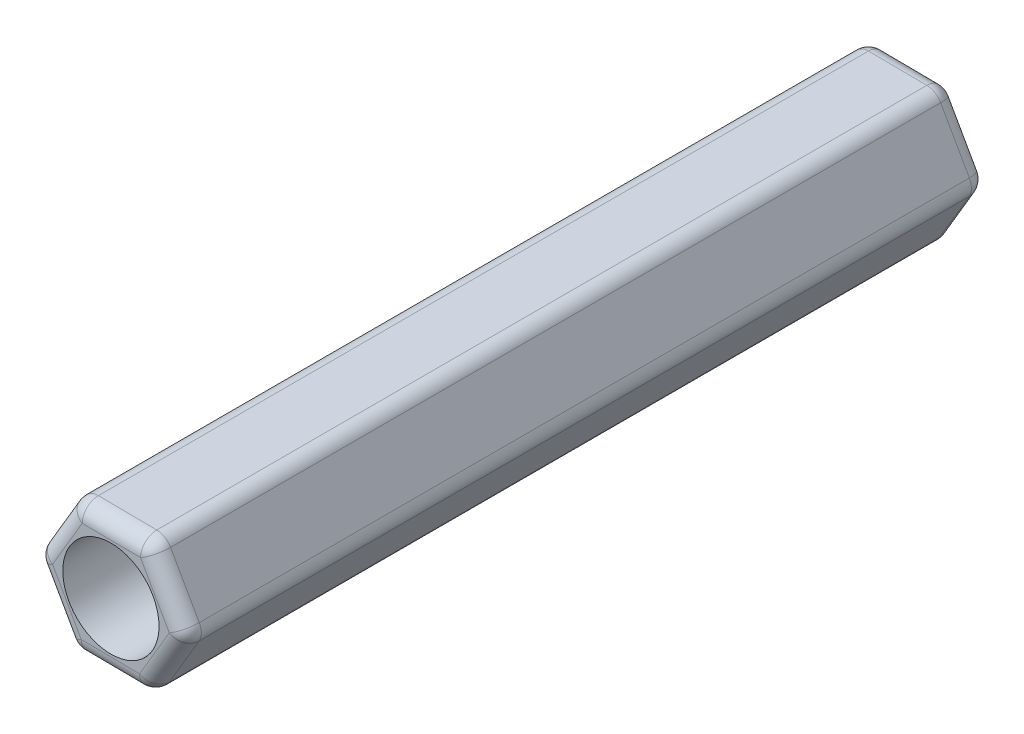
from build123d import *

# Parameters (mm, degrees)
SALIENTE_EXTRUIR1_DEPTH = 25
CROQUIS3_R              = 1.5
CORTAR_EXTRUIR1_DEPTH   = 25
REDONDEO1_R             = 0.5


with BuildPart() as part:
    # Croquis1 → Saliente-Extruir1 (new body)
    with BuildSketch(Plane.XY):
        Polygon((1.178162087, -2.086328696), (2.395894695, -0.022846051), (1.217732608, 2.063482646), (-1.178162087, 2.086328696), (-2.395894695, 0.022846051), (-1.217732608, -2.063482646), align=None)
    extrude(amount=SALIENTE_EXTRUIR1_DEPTH)

    # Croquis3 → Cortar-Extruir1 (cut)
    with BuildSketch(Plane.XY.offset(25)):
        Circle(CROQUIS3_R)
    extrude(amount=-CORTAR_EXTRUIR1_DEPTH, mode=Mode.SUBTRACT)

    # Redondeo1
    redondeo1_edges = [part.edges().sort_by_distance(p)[0] for p in [
        (0.01978526, 2.074905671, 25),
        (1.806813652, 1.020318297, 25),
        (1.217732608, 2.063482646, 12.5),
        (1.787028391, -1.054587374, 25),
        (2.395894695, -0.022846051, 12.5),
        (-0.01978526, -2.074905671, 25),
        (1.178162087, -2.086328696, 12.5),
        (-1.806813652, -1.020318297, 25),
        (-1.217732608, -2.063482646, 12.5),
        (-1.178162087, 2.086328696, 12.5),
        (-1.787028391, 1.054587374, 25),
        (-2.395894695, 0.022846051, 12.5),
        (1.787028391, -1.054587374, 0),
        (1.806813652, 1.020318297, 0),
        (0.01978526, 2.074905671, 0),
        (-1.787028391, 1.054587374, 0),
        (-1.806813652, -1.020318297, 0),
        (-0.01978526, -2.074905671, 0),
    ]]
    fillet(redondeo1_edges, radius=REDONDEO1_R)


solid = part.part
